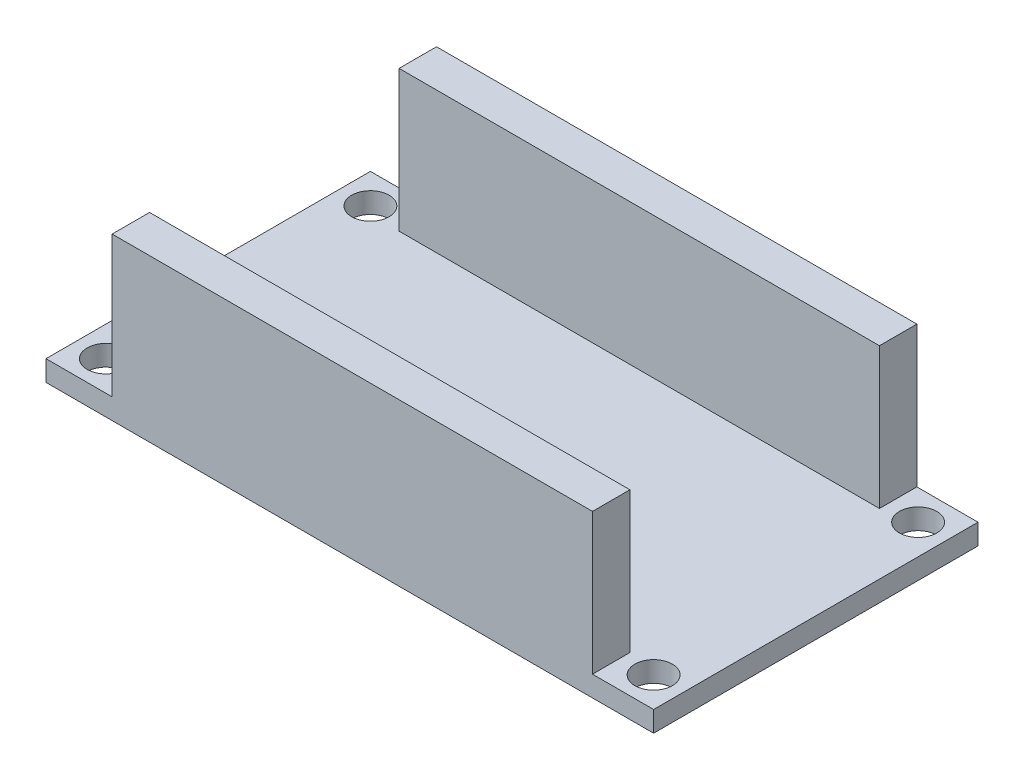
from build123d import *

# Parameters (mm, degrees)
SKETCH1_W           = 48.7
SKETCH1_H           = 26
SKETCH1_R           = 1.5
BOSS_EXTRUDE1_DEPTH = 1.65
SKETCH2_W           = 38.5
SKETCH2_H           = 3
BOSS_EXTRUDE2_DEPTH = 11.3


with BuildPart() as part:
    # Sketch1 → Boss-Extrude1 (new body)
    with BuildSketch(Plane(origin=(0, 0, 0), x_dir=(1, 0, 0), z_dir=(0, 1, 0))):
        Rectangle(SKETCH1_W, SKETCH1_H)
        with Locations((-21.95, 10.6)):
            Circle(SKETCH1_R, mode=Mode.SUBTRACT)
        with Locations((-21.95, -10.6)):
            Circle(SKETCH1_R, mode=Mode.SUBTRACT)
        with Locations((21.95, -10.6)):
            Circle(SKETCH1_R, mode=Mode.SUBTRACT)
        with Locations((21.95, 10.6)):
            Circle(SKETCH1_R, mode=Mode.SUBTRACT)
    extrude(amount=BOSS_EXTRUDE1_DEPTH)

    # Sketch2 → Boss-Extrude2 (add)
    with BuildSketch(Plane(origin=(0, 1.65, 0), x_dir=(1, 0, 0), z_dir=(0, 1, 0))):
        with Locations((0.2, 11.5)):
            Rectangle(SKETCH2_W, SKETCH2_H)
        with Locations((0.2, -11.5)):
            Rectangle(SKETCH2_W, SKETCH2_H)
    extrude(amount=BOSS_EXTRUDE2_DEPTH)


solid = part.part
